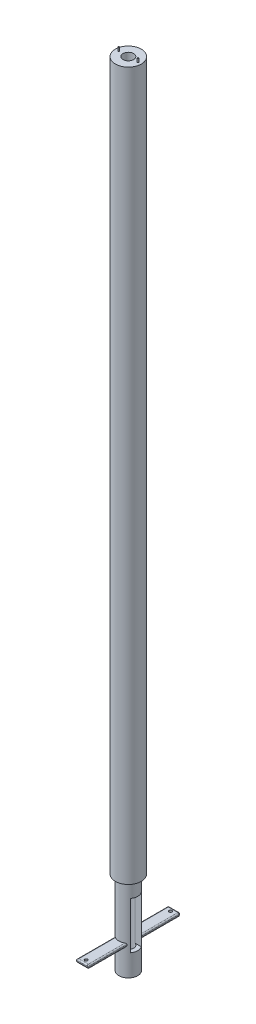
from build123d import *

# Parameters (mm, degrees)
SWEEP3_PROFILE_R         = 4
SWEEP4_PROFILE_R         = 5.5
SKETCH45_R               = 2.25
CUT_EXTRUDE2_DEPTH       = 337.377466094
SWEEP5_PROFILE_R         = 0.25
SWEEP6_PROFILE_R         = 0.25
SKETCH72_W               = 4.5
SKETCH72_H               = 20
CUT_EXTRUDE6_DEPTH       = 20
BOSS_EXTRUDE1_DEPTH      = 2.5
BOSS_EXTRUDE1_DEPTH_BACK = 2.5
BOSS_EXTRUDE3_DEPTH      = 2.5
BOSS_EXTRUDE3_DEPTH_BACK = 2.5
SKETCH76_4_W             = 16.5
SKETCH76_4_H             = 1.4
SKETCH77_R               = 0.612238256
CUT_EXTRUDE7_DEPTH       = 20
FILLET1_R                = 0.5


with BuildPart() as part:
    # Sweep3: sweep along a path in Sketch31
    with BuildLine(Plane.XY) as sweep3_path:
        Line((0, 0), (0, 35.470165431))
    # Sweep3 profile (on start of the path) → Sweep3 (sweep)
    with BuildSketch(Plane.ZX):
        Circle(SWEEP3_PROFILE_R)
    sweep(path=sweep3_path.line)

    # Sweep4: sweep along a path in Sketch38
    with BuildLine(Plane.XY) as sweep4_path:
        Line((0, 35.470165431), (0, 336.287525335))
    # Sweep4 profile (on start of the path) → Sweep4 (sweep)
    with BuildSketch(Plane.ZX.offset(35.470165431)):
        Circle(SWEEP4_PROFILE_R)
    sweep(path=sweep4_path.line)

    # Sketch45 → Cut-Extrude2 (cut, through all)
    with BuildSketch(Plane(origin=(0, 0, 0), x_dir=(1, 0, 0), z_dir=(0, 1, 0))):
        Circle(SKETCH45_R)
    extrude(amount=CUT_EXTRUDE2_DEPTH, mode=Mode.SUBTRACT)

    # Sweep5: sweep along a curve in space
    with BuildLine() as sweep5_path:
        Line((4.125, 336.287525335, 5.531e-06), (4.125, 337.787525335, 5.531e-06))
    # Sweep5 profile (on start of the path) → Sweep5 (sweep)
    with BuildSketch(Plane(origin=(4.125, 336.287525335, 5.531e-06), x_dir=(0, 0, 1), z_dir=(0, 1, 0))):
        Circle(SWEEP5_PROFILE_R)
    sweep(path=sweep5_path.line)

    # Sweep6: sweep along a curve in space
    with BuildLine() as sweep6_path:
        Line((-4.125, 336.287525335, 9.31e-07), (-4.125, 337.787525335, 9.31e-07))
    # Sweep6 profile (on start of the path) → Sweep6 (sweep)
    with BuildSketch(Plane(origin=(-4.125, 336.287525335, 9.31e-07), x_dir=(0, 0, 1), z_dir=(0, 1, 0))):
        Circle(SWEEP6_PROFILE_R)
    sweep(path=sweep6_path.line)

    # Sketch72 → Cut-Extrude6 (cut)
    with BuildSketch(Plane(origin=(0, 0, 0), x_dir=(0, 0, -1), z_dir=(1, 0, 0))):
        with Locations((-0.068000409, 19.236124066)):
            Rectangle(SKETCH72_W, SKETCH72_H)
    extrude(amount=CUT_EXTRUDE6_DEPTH, mode=Mode.SUBTRACT)

    # Sketch76 → Boss-Extrude1 (add, two sides: drawn at the far end of the back side and taken through both)
    with BuildSketch(Plane(origin=(0, 0, 0), x_dir=(0, 0, -1), z_dir=(1, 0, 0)).offset(-BOSS_EXTRUDE1_DEPTH_BACK)):
        Polygon((-3, 12.070165431), (-3, 12.770165431), (-19.5, 12.770165431), (-19.5, 12.370165431), (-19.5, 11.370165431), (-3, 11.370165431), align=None)
    extrude(amount=BOSS_EXTRUDE1_DEPTH + BOSS_EXTRUDE1_DEPTH_BACK)

    # Sketch76<4> → Boss-Extrude3 (add, two sides: drawn at the far end of the back side and taken through both)
    with BuildSketch(Plane(origin=(0, 0, 0), x_dir=(0, 0, -1), z_dir=(1, 0, 0)).offset(-BOSS_EXTRUDE3_DEPTH_BACK)):
        with Locations((11.25, 12.070165431)):
            Rectangle(SKETCH76_4_W, SKETCH76_4_H)
    extrude(amount=BOSS_EXTRUDE3_DEPTH + BOSS_EXTRUDE3_DEPTH_BACK)

    # Sketch77 → Cut-Extrude7 (cut)
    with BuildSketch(Plane(origin=(0, 0, 0), x_dir=(1, 0, 0), z_dir=(0, 1, 0))):
        with Locations((0, 17.9)):
            Circle(SKETCH77_R)
        with Locations((0, -17.9)):
            Circle(SKETCH77_R)
    extrude(amount=CUT_EXTRUDE7_DEPTH, mode=Mode.SUBTRACT)

    # Fillet1
    fillet1_edges = [part.edges().sort_by_distance(p)[0] for p in [
        (-2.5, 12.770165431, 11.3112495),
        (-2.5, 11.370165431, 11.3112495),
        (2.5, 12.070165431, 19.5),
        (0, 11.370165431, 19.5),
        (2.5, 11.370165431, 11.3112495),
        (2.5, 12.770165431, 11.3112495),
        (0, 12.770165431, 19.5),
        (-2.5, 11.370165431, -11.3112495),
        (-2.5, 12.770165431, -11.3112495),
        (0, 12.770165431, -19.5),
        (0, 11.370165431, -19.5),
        (2.5, 12.070165431, -19.5),
        (2.5, 11.370165431, -11.3112495),
        (2.5, 12.770165431, -11.3112495),
    ]]
    fillet(fillet1_edges, radius=FILLET1_R)


solid = part.part
